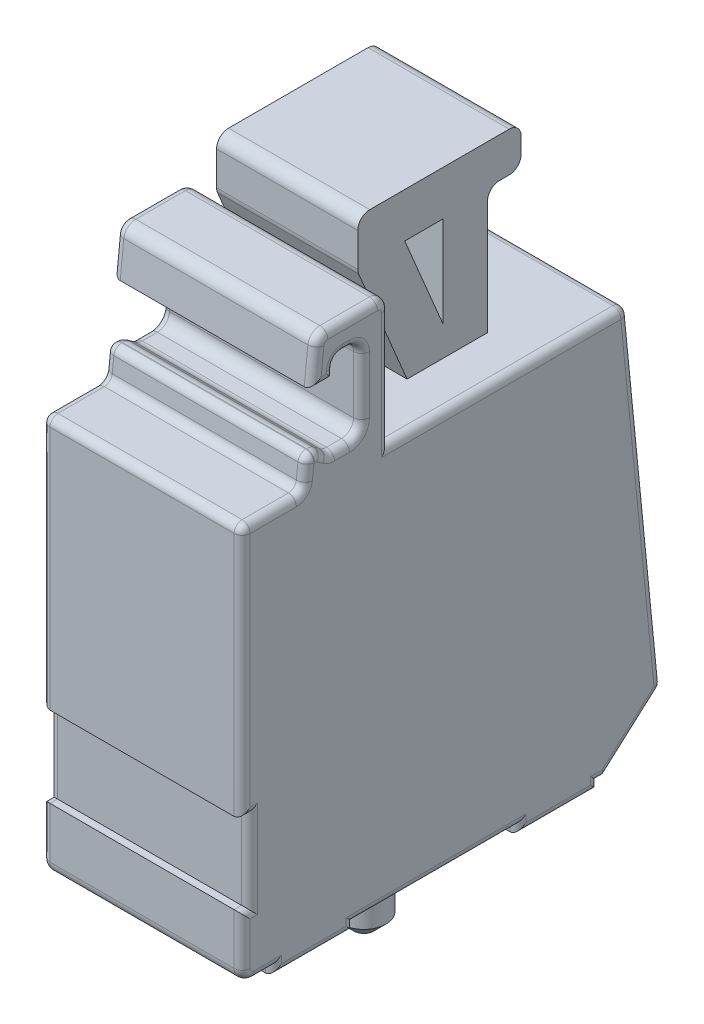
from build123d import *

# Parameters (mm, degrees)
BOSS_EXTRUDE1_DEPTH            = 5
CUT_EXTRUDE1_REACH             = 18.764
SKETCH2_W                      = 2.576928983
SKETCH2_H                      = 4.135607001
CUT_EXTRUDE1_DIRECTION_2_DEPTH = 17.763917389
CUT_EXTRUDE2_DEPTH             = 1
SKETCH5_R                      = 1.571107084
SKETCH5_R_2                    = 0.423919705
CUT_EXTRUDE3_DEPTH             = 2
SKETCH6_W                      = 1.147535998
SKETCH6_H                      = 1.245970817
CUT_EXTRUDE4_DEPTH             = 2
CHAMFER1_SIZE                  = 1
FILLET1_R                      = 0.2
SKETCH7_W                      = 3.649261606
SKETCH7_H                      = 8.287660763
CUT_EXTRUDE5_DEPTH             = 19.230953153
BOSS_EXTRUDE2_DEPTH            = 2.5
BOSS_EXTRUDE2_DEPTH_BACK       = 0.186725
SKETCH8_R                      = 0.55
CHAMFER2_SIZE                  = 0.3


with BuildPart() as part:
    # Sketch1 → Boss-Extrude1 (new body)
    with BuildSketch(Plane(origin=(0, 0, 0), x_dir=(0, 0, -1), z_dir=(1, 0, 0))):
        with BuildLine():
            Line((0.780675664, 0), (2.798128022, 0))
            Line((2.798128022, 0), (2.798128022, 0.18672462))
            Line((2.798128022, 0.18672462), (6.890272134, 0.18672462))
            Line((6.890272134, 0.18672462), (6.890272134, 0))
            Line((6.890272134, 0), (8.907724492, 0))
            Line((8.907724492, 0), (8.907724492, 0.18672462))
            Line((8.907724492, 0.18672462), (9.068833328, 0.18672462))
            Line((9.068833328, 0.18672462), (10.5, 1.460347484))
            Line((10.5, 1.460347484), (9.644210748, 10.1))
            Line((9.644210748, 10.1), (7.310289875, 10.1))
            Line((7.310289875, 10.1), (7.310289875, 12.941354969))
            ThreePointArc((7.310289875, 12.941354969), (7.39815784, 13.153487004), (7.610289875, 13.241354969))
            Line((7.610289875, 13.241354969), (7.852971354, 13.241354969))
            ThreePointArc((7.852971354, 13.241354969), (8.065103388, 13.329222935), (8.152971354, 13.541354969))
            Line((8.152971354, 13.541354969), (8.152971354, 13.933361802))
            ThreePointArc((8.152971354, 13.933361802), (8.065103388, 14.145493836), (7.852971354, 14.233361802))
            Line((7.852971354, 14.233361802), (4.369207264, 14.233361802))
            ThreePointArc((4.369207264, 14.233361802), (4.157075229, 14.145493836), (4.069207264, 13.933361802))
            Line((4.069207264, 13.933361802), (4.069207264, 13.092577376))
            ThreePointArc((4.069207264, 13.092577376), (4.075129336, 13.03326319), (4.092661748, 12.976290757))
            Line((4.092661748, 12.976290757), (5.302134, 10.1))
            Line((5.302134, 10.1), (3.68027735, 10.1))
            Line((3.68027735, 10.1), (3.68027735, 13.029673889))
            ThreePointArc((3.68027735, 13.029673889), (3.592409385, 13.241805923), (3.38027735, 13.329673889))
            Line((3.38027735, 13.329673889), (2.140403949, 13.329673889))
            ThreePointArc((2.140403949, 13.329673889), (1.9394634, 13.25243586), (1.841991197, 13.060493194))
            Line((1.841991197, 13.060493194), (1.752803127, 12.196915718))
            Line((1.752803127, 12.196915718), (2.306514056, 12.196915718))
            Line((2.306514056, 12.196915718), (2.306514056, 12.6464679))
            Line((2.306514056, 12.6464679), (2.681693391, 12.6464679))
            ThreePointArc((2.681693391, 12.6464679), (2.893825425, 12.558599934), (2.981693391, 12.3464679))
            Line((2.981693391, 12.3464679), (2.981693391, 10.91364601))
            ThreePointArc((2.981693391, 10.91364601), (2.893825425, 10.701513976), (2.681693391, 10.61364601))
            Line((2.681693391, 10.61364601), (2.307330654, 10.61364601))
            ThreePointArc((2.307330654, 10.61364601), (2.215973733, 10.627894522), (2.133294813, 10.66928659))
            Line((2.133294813, 10.66928659), (1.985235759, 10.774736104))
            ThreePointArc((1.985235759, 10.774736104), (1.902556839, 10.816128172), (1.811199918, 10.830376684))
            Line((1.811199918, 10.830376684), (1.611670474, 10.830376684))
            Line((1.611670474, 10.830376684), (1.536239041, 10.1))
            Line((1.536239041, 10.1), (0, 10.1))
            Line((0, 10.1), (0, 3.777035106))
            Line((0, 3.777035106), (0.18672462, 3.777035106))
            Line((0.18672462, 3.777035106), (0.18672462, 1.759582748))
            Line((0.18672462, 1.759582748), (0, 1.759582748))
            Line((0, 1.759582748), (0, 0.48672462))
            ThreePointArc((0, 0.48672462), (0.087867966, 0.274592586), (0.3, 0.18672462))
            Line((0.3, 0.18672462), (0.780675664, 0.18672462))
            Line((0.780675664, 0.18672462), (0.780675664, 0))
        make_face()
    extrude(amount=BOSS_EXTRUDE1_DEPTH)

    # Cut-Extrude1: up to this plane
    cut_extrude1_end = Plane(origin=(5, 12.976290757, -4.092661748), z_dir=(0, 0.38762206364877966, -0.9218183854603148))
    # Sketch2 → Cut-Extrude1 (cut, up to the surface)
    with BuildSketch(Plane(origin=(0, 0, -7.310289875), x_dir=(-1, 0, 0), z_dir=(0, 0, -1)), mode=Mode.PRIVATE) as cut_extrude1_sk1:
        with Locations((0.996330054, 12.167803501)):
            Rectangle(SKETCH2_W, SKETCH2_H)
    cut_extrude1_tool1 = split(extrude(cut_extrude1_sk1.sketch, amount=-CUT_EXTRUDE1_REACH, mode=Mode.PRIVATE), bisect_by=cut_extrude1_end, keep=Keep.BOTH, mode=Mode.PRIVATE)
    add(cut_extrude1_tool1.solids().sort_by_distance((-0.99633, 12.167804, -7.31029))[0], mode=Mode.SUBTRACT)
    # Sketch2 → Cut-Extrude1 (cut, up to the surface)
    with BuildSketch(Plane(origin=(0, 0, -7.310289875), x_dir=(-1, 0, 0), z_dir=(0, 0, -1)), mode=Mode.PRIVATE) as cut_extrude1_sk2:
        with Locations((-5.108197618, 12.167803501)):
            Rectangle(SKETCH2_W, SKETCH2_H)
    cut_extrude1_tool2 = split(extrude(cut_extrude1_sk2.sketch, amount=-CUT_EXTRUDE1_REACH, mode=Mode.PRIVATE), bisect_by=cut_extrude1_end, keep=Keep.BOTH, mode=Mode.PRIVATE)
    add(cut_extrude1_tool2.solids().sort_by_distance((5.108198, 12.167804, -7.31029))[0], mode=Mode.SUBTRACT)

    # Sketch2 → Cut-Extrude1 direction 2 (cut)
    with BuildSketch(Plane(origin=(0, 0, -7.310289875), x_dir=(-1, 0, 0), z_dir=(0, 0, -1))):
        with Locations((0.996330054, 12.167803501)):
            Rectangle(SKETCH2_W, SKETCH2_H)
        with Locations((-5.108197618, 12.167803501)):
            Rectangle(SKETCH2_W, SKETCH2_H)
    extrude(amount=CUT_EXTRUDE1_DIRECTION_2_DEPTH, mode=Mode.SUBTRACT)

    # Sketch4 → Cut-Extrude2 (cut)
    with BuildSketch(Plane(origin=(3.819733126, 0, 0), x_dir=(0, 0, -1), z_dir=(1, 0, 0))):
        Polygon((5.24305391, 13.117891526), (6.194819599, 10.854462292), (6.194819599, 13.117891526), align=None)
    cut_extrude2 = extrude(amount=-CUT_EXTRUDE2_DEPTH, mode=Mode.SUBTRACT)

    # Mirror1: Cut-Extrude2 across plane
    add(cut_extrude2.mirror(Plane(origin=(2.055933782, 0, 0), x_dir=(0, 0, 1), z_dir=(1, 0, 0))), mode=Mode.SUBTRACT)

    # Sketch5 → Cut-Extrude3 (cut)
    with BuildSketch(Plane(origin=(0, 0.523347901, -10.592813244), x_dir=(1, 0, 0), z_dir=(0, -0.09857127375436353, 0.9951299935136325))):
        with Locations(Location((2.087916883, 6.113059116, 0), (0, 0, 270))):
            Circle(SKETCH5_R)
        with Locations(Location((2.087916883, 2.683464141, 0), (0, 0, 270))):
            Circle(SKETCH5_R_2)
    extrude(amount=CUT_EXTRUDE3_DEPTH, mode=Mode.SUBTRACT)

    # Sketch6 → Cut-Extrude4 (cut)
    with BuildSketch(Plane(origin=(0, 0.847004547, -8.550966187), x_dir=(-1, 0, 0), z_dir=(0, 0.09857127375436353, -0.9951299935136325))):
        with Locations((-2.015441492, 5.508956429)):
            Rectangle(SKETCH6_W, SKETCH6_H)
    extrude(amount=-CUT_EXTRUDE4_DEPTH, mode=Mode.SUBTRACT)

    # Chamfer1
    # the kernel refuses this chamfer: 1 mm, written as the material it adds along each edge
    with BuildSketch(Plane(origin=(2.087916883, 6.409493832, -7.999981233), x_dir=(0, -0.9951299935136325, -0.09857127375436392), z_dir=(-1, 0, 0))) as chamfer1_piece_1_section:
        Polygon((1.571107084, -CHAMFER1_SIZE), (1.571107084 - CHAMFER1_SIZE, 0), (1.571107084, 0), align=None)
    chamfer1_piece_1 = revolve(axis=Axis((2.087916883, 6.409493832, -7.999981233), (0, -0.09857127375436353, 0.9951299935136325)), mode=Mode.PRIVATE)
    chamfer1_piece_1 = split(chamfer1_piece_1, bisect_by=Plane(origin=(2.014969987, 5.743132508, -8.412109978), z_dir=(0, -0.9951299935136325, -0.09857127375436353)), keep=Keep.TOP, mode=Mode.PRIVATE)
    add(chamfer1_piece_1)
    with BuildSketch(Plane(origin=(2.087916883, 6.409493832, -7.999981233), x_dir=(0, -0.9951299935136325, -0.09857127375436392), z_dir=(-1, 0, 0))) as chamfer1_piece_2_section:
        Polygon((1.571107084, -CHAMFER1_SIZE), (1.571107084 - CHAMFER1_SIZE, 0), (1.571107084, 0), align=None)
    chamfer1_piece_2 = revolve(axis=Axis((2.087916883, 6.409493832, -7.999981233), (0, -0.09857127375436353, 0.9951299935136325)), mode=Mode.PRIVATE)
    chamfer1_piece_2 = split(chamfer1_piece_2, bisect_by=Plane(origin=(2.589209491, 6.356678358, -8.340121794), z_dir=(1, 0, 0)), keep=Keep.TOP, mode=Mode.PRIVATE)
    add(chamfer1_piece_2)
    with BuildSketch(Plane(origin=(2.087916883, 6.409493832, -7.999981233), x_dir=(0, -0.9951299935136325, -0.09857127375436392), z_dir=(-1, 0, 0))) as chamfer1_piece_3_section:
        Polygon((1.571107084, -CHAMFER1_SIZE), (1.571107084 - CHAMFER1_SIZE, 0), (1.571107084, 0), align=None)
    chamfer1_piece_3 = revolve(axis=Axis((2.087916883, 6.409493832, -7.999981233), (0, -0.09857127375436353, 0.9951299935136325)), mode=Mode.PRIVATE)
    chamfer1_piece_3 = split(chamfer1_piece_3, bisect_by=Plane(origin=(1.441673493, 6.361160313, -8.347157489), z_dir=(-1, 0, 0)), keep=Keep.TOP, mode=Mode.PRIVATE)
    add(chamfer1_piece_3)
    with BuildSketch(Plane(origin=(2.087916883, 6.409493832, -7.999981233), x_dir=(0, -0.9951299935136325, -0.09857127375436392), z_dir=(-1, 0, 0))) as chamfer1_piece_4_section:
        Polygon((1.571107084, -CHAMFER1_SIZE), (1.571107084 - CHAMFER1_SIZE, 0), (1.571107084, 0), align=None)
    chamfer1_piece_4 = revolve(axis=Axis((2.087916883, 6.409493832, -7.999981233), (0, -0.09857127375436353, 0.9951299935136325)), mode=Mode.PRIVATE)
    chamfer1_piece_4 = split(chamfer1_piece_4, bisect_by=Plane(origin=(2.011736054, 6.981997171, -8.278811177), z_dir=(0, 0.9951299935136325, 0.09857127375436353)), keep=Keep.TOP, mode=Mode.PRIVATE)
    add(chamfer1_piece_4)

    # Fillet1
    fillet1_edges = [part.edges().sort_by_distance(p)[0] for p in [
        (5, 13.241805923, -3.592409385),
        (5, 13.329673889, -2.76034065),
        (5, 13.25243586, -1.9394634),
        (5, 12.628704456, -1.797397162),
        (5, 12.196915718, -2.029658591),
        (5, 12.421691809, -2.306514056),
        (5, 12.6464679, -2.494103723),
        (5, 12.558599934, -2.893825425),
        (5, 0.09336231, -2.798128022),
        (5, 11.630056955, -2.981693391),
        (5, 10.701513976, -2.893825425),
        (5, 10.61364601, -2.494512022),
        (5, 10.627894522, -2.215973733),
        (5, 10.722011347, -2.059265286),
        (5, 10.816128172, -1.902556839),
        (5, 10.830376684, -1.711435196),
        (5, 10.465188342, -1.573954757),
        (5, 10.1, -0.76811952),
        (5, 6.938517553, 0),
        (5, 0.18672462, -4.844200078),
        (5, 3.777035106, -0.09336231),
        (5, 2.768308927, -0.18672462),
        (5, 1.759582748, -0.09336231),
        (5, 1.123153684, 0),
        (5, 0.274592586, -0.087867966),
        (5, 0.18672462, -0.540337832),
        (5, 0.09336231, -6.890272134),
        (5, 0, -7.898998313),
        (2.087916883, 8.170092161, -9.835375193),
        (2.087916883, 3.615598768, -10.28651446),
        (5, 0.09336231, -8.907724492),
        (5, 0.18672462, -8.98827891),
        (5, 0.823536052, -9.784416664),
        (5, 5.780173742, -10.072105374),
        (0, 0.18672462, -0.540337832),
        (5, 10.1, -6.662244049),
        (0, 0.274592586, -0.087867966),
        (0, 1.123153684, 0),
        (0, 1.759582748, -0.09336231),
        (0, 2.768308927, -0.18672462),
        (0, 3.777035106, -0.09336231),
        (0, 6.938517553, 0),
        (0, 10.1, -0.76811952),
        (0, 10.465188342, -1.573954757),
        (0, 10.830376684, -1.711435196),
        (0, 10.816128172, -1.902556839),
        (0, 10.722011347, -2.059265286),
        (0, 10.627894522, -2.215973733),
        (0, 10.61364601, -2.494512022),
        (5, 0.09336231, -0.780675664),
        (0, 10.701513976, -2.893825425),
        (0, 11.630056955, -2.981693391),
        (0, 12.558599934, -2.893825425),
        (0, 12.6464679, -2.494103723),
        (0, 12.421691809, -2.306514056),
        (0, 12.196915718, -2.029658591),
        (0, 12.628704456, -1.797397162),
        (0, 13.25243586, -1.9394634),
        (0, 13.329673889, -2.76034065),
        (0, 13.241805923, -3.592409385),
        (0, 11.564836945, -3.68027735),
        (0, 10.1, -6.662244049),
        (0, 5.780173742, -10.072105374),
        (0, 0.823536052, -9.784416664),
        (0, 0.18672462, -8.98827891),
        (0, 0.09336231, -8.907724492),
        (0, 0, -7.898998313),
        (0, 0.09336231, -6.890272134),
        (0, 0.18672462, -4.844200078),
        (0, 0.09336231, -2.798128022),
        (0, 0, -1.789401843),
        (0, 0.09336231, -0.780675664),
        (2.5, 10.1, 0),
        (2.5, 10.1, -1.536239041),
        (2.5, 10.830376684, -1.611670474),
        (2.5, 12.6464679, -2.306514056),
        (2.5, 10.1, -9.644210748),
        (2.5, 1.460347484, -10.5),
        (5, 0, -1.789401843),
        (5, 11.564836945, -3.68027735),
    ]]
    fillet(fillet1_edges, radius=FILLET1_R)

    # Sketch7 → Cut-Extrude5 (cut, through all)
    with BuildSketch(Plane.XZ.offset(-0.18672462)):
        with Locations((2.5, -4.76389411)):
            Rectangle(SKETCH7_W, SKETCH7_H)
    extrude(amount=CUT_EXTRUDE5_DEPTH, mode=Mode.SUBTRACT)


with BuildPart() as body_2:
    # Sketch8 → Boss-Extrude2 (new, two sides: drawn at the far end of the back side and taken through both)
    with BuildSketch(Plane.XZ.offset(-BOSS_EXTRUDE2_DEPTH_BACK)):
        with Locations(Location((2.5, -5.540931167, 0), (0, 0, 270))):
            Circle(SKETCH8_R)
    extrude(amount=BOSS_EXTRUDE2_DEPTH + BOSS_EXTRUDE2_DEPTH_BACK)

    # Chamfer2
    chamfer2_edges = [body_2.edges().sort_by_distance(p)[0] for p in [
        (2.5, -2.5, -4.990931167),
    ]]
    chamfer(chamfer2_edges, length=CHAMFER2_SIZE)


solid = Compound([part.part, body_2.part])
